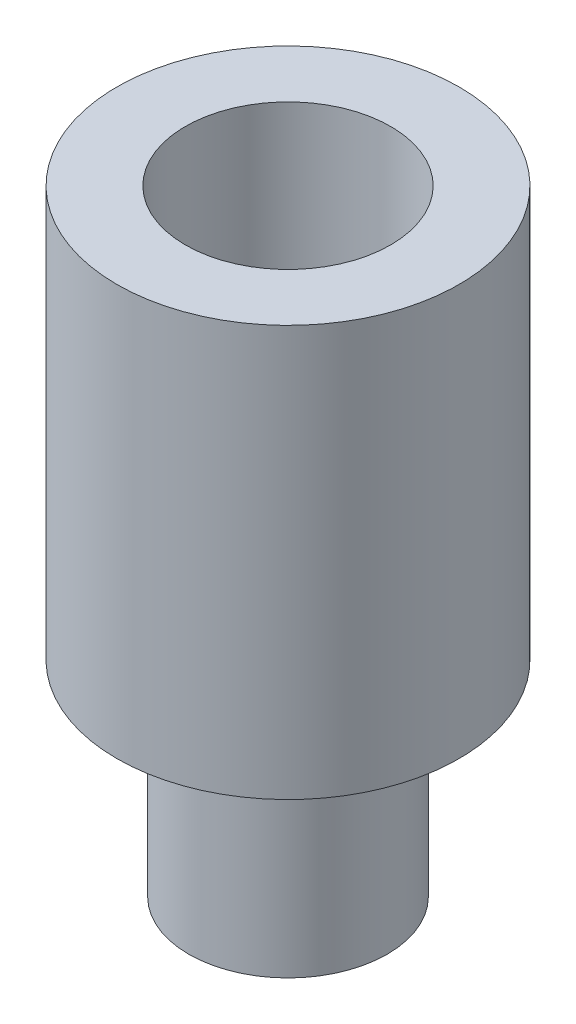
from build123d import *

# Parameters (mm, degrees)
SKETCH1_R           = 12.5
SKETCH1_R_2         = 7.5
BOSS_EXTRUDE1_DEPTH = 24
SKETCH3_R           = 3
CUT_EXTRUDE1_DEPTH  = 15
THREAD1_PITCH       = 1
SKETCH11_W          = 6.5
SKETCH11_H          = 8
SKETCH12_R          = 12.5
SKETCH12_R_2        = 7.5
BOSS_EXTRUDE2_DEPTH = 6
SKETCH13_R          = 3
CUT_EXTRUDE3_DEPTH  = 35.820970693
BOSS_EXTRUDE3_START = 20
SKETCH14_R          = 7.25
SKETCH14_R_2        = 6
BOSS_EXTRUDE3_DEPTH = 20
SKETCH15_R          = 7.25
CUT_EXTRUDE4_DEPTH  = 5


with BuildPart() as part:
    # Sketch1 → Boss-Extrude1 (new body)
    with BuildSketch(Plane(origin=(0, 0, 0), x_dir=(1, 0, 0), z_dir=(0, 1, 0))):
        with Locations(Location((0, 0, 0), (0, 0, 270))):
            Circle(SKETCH1_R)
        with Locations(Location((0, 0, 0), (0, 0, 270))):
            Circle(SKETCH1_R_2, mode=Mode.SUBTRACT)
    extrude(amount=BOSS_EXTRUDE1_DEPTH)

    # Sketch2 → Revolve1 (revolve)
    with BuildSketch(Plane.XY, mode=Mode.PRIVATE) as revolve1_sk:
        Polygon((0, 0), (0, -20), (6, -20), (6, -8), (12.5, 0), (12.5, 5), (0, 5), align=None)
    revolve(revolve1_sk.sketch.rotate(Axis((0, 0, 0), (0, -1, 0)), 180), axis=Axis((0, 0, 0), (0, -1, 0)))

    # Sketch3 → Cut-Extrude1 (cut)
    with BuildSketch(Plane.XZ.offset(20)):
        Circle(SKETCH3_R)
    extrude(amount=-CUT_EXTRUDE1_DEPTH, mode=Mode.SUBTRACT)

    # Thread1: the profile of Thread Profile2 profile screwed along a right-hand helix of 20 turns, 8 arcs to a turn; built about Z, then put on its axis
    thread1_z = Axis((0, 0, 0), (0, 0, 1))
    thread1_corners = [(2.9997, 0, -0.000173205), (3.541265875, 0, 0.312499999), (3.541265875, 0, 0.437499999), (2.9997, 0, 0.750173202)]
    with BuildLine(mode=Mode.PRIVATE) as thread1_profile:
        Line(thread1_corners[0], thread1_corners[1])
        Line(thread1_corners[1], thread1_corners[2])
        Line(thread1_corners[2], thread1_corners[3])
        Line(thread1_corners[3], thread1_corners[0])
    thread1_cap = Face(thread1_profile.wire())
    thread1_turn_angles = [0, 22.5, 45, 67.5, 90, 112.5, 135, 157.5, 180, 202.5, 225, 247.5, 270, 292.5, 315, 337.5, 360]
    thread1_turn_weights = [1, 0.9238795325112867, 1, 0.9238795325112867, 1, 0.9238795325112867, 1, 0.9238795325112867, 1, 0.9238795325112867, 1, 0.9238795325112867, 1, 0.9238795325112867, 1, 0.9238795325112867, 1]
    thread1_turn_rails = [Edge.make_bspline([Vector(p[0], p[1], 0).rotate(thread1_z, thread1_turn_angles[k]) / thread1_turn_weights[k] + Vector(0, 0, p[2] + THREAD1_PITCH * thread1_turn_angles[k] / 360) for k in range(17)], [0, 0, 0, 1, 1, 2, 2, 3, 3, 4, 4, 5, 5, 6, 6, 7, 7, 8, 8, 8], 2, thread1_turn_weights) for p in thread1_corners]
    thread1_turn_sides = [Face.make_surface_from_curves(thread1_turn_rails[p[0]], thread1_turn_rails[p[1]]) for p in [(0, 1), (1, 2), (2, 3), (3, 0)]]
    thread1 = Plane(origin=(0, -20, 0), x_dir=(1, 0, 0), z_dir=(0, 1, 0)) * Solid(Shell([*[p.moved(Location((0, 0, THREAD1_PITCH * i))) for i in range(20) for p in thread1_turn_sides], thread1_cap, thread1_cap.rotate(thread1_z, 7200).moved(Location((0, 0, THREAD1_PITCH * 7200 / 360)))]))
    add(thread1, mode=Mode.SUBTRACT)

    # Sketch11 → Cut-Revolve1 (revolve, cut)
    with BuildSketch(Plane.XY, mode=Mode.PRIVATE) as cut_revolve1_sk:
        with Locations((9.25, -4)):
            Rectangle(SKETCH11_W, SKETCH11_H)
    revolve(cut_revolve1_sk.sketch.rotate(Axis((0, 0, 0), (0, -1, 0)), 180), axis=Axis((0, 0, 0), (0, -1, 0)), mode=Mode.SUBTRACT)

    # Sketch12 → Boss-Extrude2 (add)
    with BuildSketch(Plane(origin=(0, 24, 0), x_dir=(1, 0, 0), z_dir=(0, 1, 0))):
        with Locations(Location((0, 0, 0), (0, 0, 270))):
            Circle(SKETCH12_R)
        Circle(SKETCH12_R_2, mode=Mode.SUBTRACT)
    extrude(amount=BOSS_EXTRUDE2_DEPTH)

    # Sketch13 → Cut-Extrude3 (cut, through all)
    with BuildSketch(Plane.XY):
        with Locations(Location((0, 18.5, 0), (0, 0, 90))):
            Circle(SKETCH13_R)
    extrude(amount=-CUT_EXTRUDE3_DEPTH, mode=Mode.SUBTRACT)

    # Sketch14 → Boss-Extrude3 (add)
    with BuildSketch(Plane.XZ.offset(BOSS_EXTRUDE3_START)):
        with Locations(Location((0, 0, 0), (0, 0, 90))):
            Circle(SKETCH14_R)
        Circle(SKETCH14_R_2, mode=Mode.SUBTRACT)
    extrude(amount=-BOSS_EXTRUDE3_DEPTH)

    # Sketch15 → Cut-Extrude4 (cut)
    with BuildSketch(Plane.XZ.offset(20)):
        with Locations(Location((0, 0, 0), (0, 0, 90))):
            Circle(SKETCH15_R)
    extrude(amount=-CUT_EXTRUDE4_DEPTH, mode=Mode.SUBTRACT)


solid = part.part
